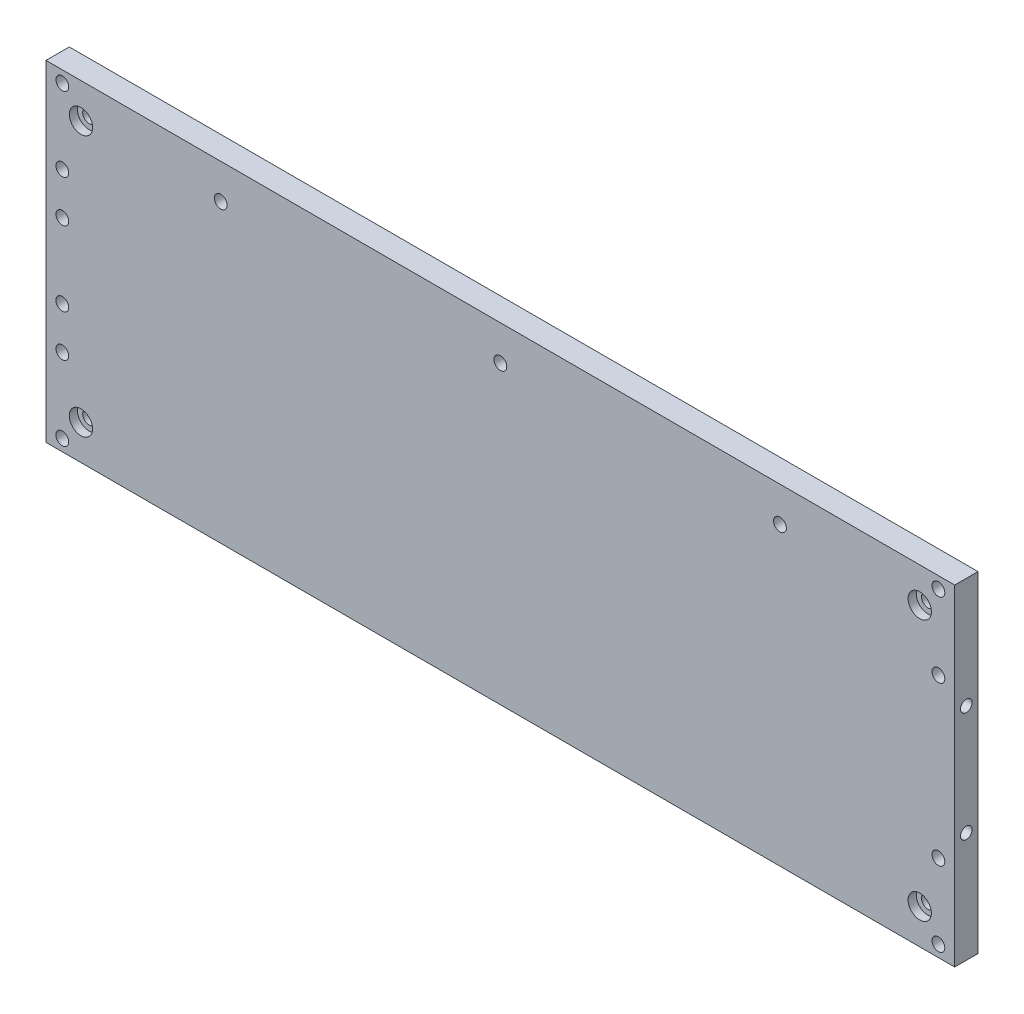
from build123d import *

# Parameters (mm, degrees)
SKETCH1_W           = 390
SKETCH1_H           = 142
BOSS_EXTRUDE1_DEPTH = 5
SKETCH2_R           = 2.75
CUT_EXTRUDE1_DEPTH  = 208.764289521
SKETCH3_R           = 2.75
CUT_EXTRUDE2_DEPTH  = 208.764289521
SKETCH4_R           = 5
CUT_EXTRUDE3_DEPTH  = 3.5
SKETCH5_R           = 2.5
CUT_EXTRUDE4_DEPTH  = 10
SKETCH6_R           = 2.75
CUT_EXTRUDE5_DEPTH  = 208.764289521


with BuildPart() as part:
    # Sketch1 → Boss-Extrude1 (new, symmetric)
    with BuildSketch(Plane.XY):
        Rectangle(SKETCH1_W, SKETCH1_H)
    extrude(amount=BOSS_EXTRUDE1_DEPTH, both=True)

    # Sketch2 → Cut-Extrude1 (cut, through all)
    with BuildSketch(Plane(origin=(0, 0, -5), x_dir=(-1, 0, 0), z_dir=(0, 0, -1))):
        with Locations((-188, 66)):
            Circle(SKETCH2_R)
        with Locations((-188, -66)):
            Circle(SKETCH2_R)
        with Locations((188, 66)):
            Circle(SKETCH2_R)
        with Locations((188, -66)):
            Circle(SKETCH2_R)
        with Locations((-188, 34)):
            Circle(SKETCH2_R)
        with Locations((-188, -34)):
            Circle(SKETCH2_R)
        with Locations((188, 34)):
            Circle(SKETCH2_R)
        with Locations((188, -34)):
            Circle(SKETCH2_R)
    extrude(amount=-CUT_EXTRUDE1_DEPTH, mode=Mode.SUBTRACT)

    # Sketch3 → Cut-Extrude2 (cut, through all)
    with BuildSketch(Plane.XY.offset(5)):
        with Locations((-180, 56)):
            Circle(SKETCH3_R)
        with Locations((180, 56)):
            Circle(SKETCH3_R)
        with Locations((180, -56)):
            Circle(SKETCH3_R)
        with Locations((-180, -56)):
            Circle(SKETCH3_R)
        with Locations((0, 56)):
            Circle(SKETCH3_R)
        with Locations((-120, 56)):
            Circle(SKETCH3_R)
        with Locations((120, 56)):
            Circle(SKETCH3_R)
    extrude(amount=-CUT_EXTRUDE2_DEPTH, mode=Mode.SUBTRACT)

    # Sketch4 → Cut-Extrude3 (cut)
    with BuildSketch(Plane.XY.offset(5)):
        with Locations((-180, 56)):
            Circle(SKETCH4_R)
        with Locations((-180, -56)):
            Circle(SKETCH4_R)
        with Locations((180, 56)):
            Circle(SKETCH4_R)
        with Locations((180, -56)):
            Circle(SKETCH4_R)
    extrude(amount=-CUT_EXTRUDE3_DEPTH, mode=Mode.SUBTRACT)

    # Sketch5 → Cut-Extrude4 (cut)
    with BuildSketch(Plane(origin=(195, 0, 0), x_dir=(0, 0, -1), z_dir=(1, 0, 0))):
        with Locations((0, 23.6)):
            Circle(SKETCH5_R)
        with Locations((0, -23.6)):
            Circle(SKETCH5_R)
    extrude(amount=-CUT_EXTRUDE4_DEPTH, mode=Mode.SUBTRACT)

    # Sketch6 → Cut-Extrude5 (cut, through all)
    with BuildSketch(Plane.XY.offset(5)):
        with Locations((-188, 16)):
            Circle(SKETCH6_R)
        with Locations((-188, -16)):
            Circle(SKETCH6_R)
    extrude(amount=-CUT_EXTRUDE5_DEPTH, mode=Mode.SUBTRACT)


solid = part.part
